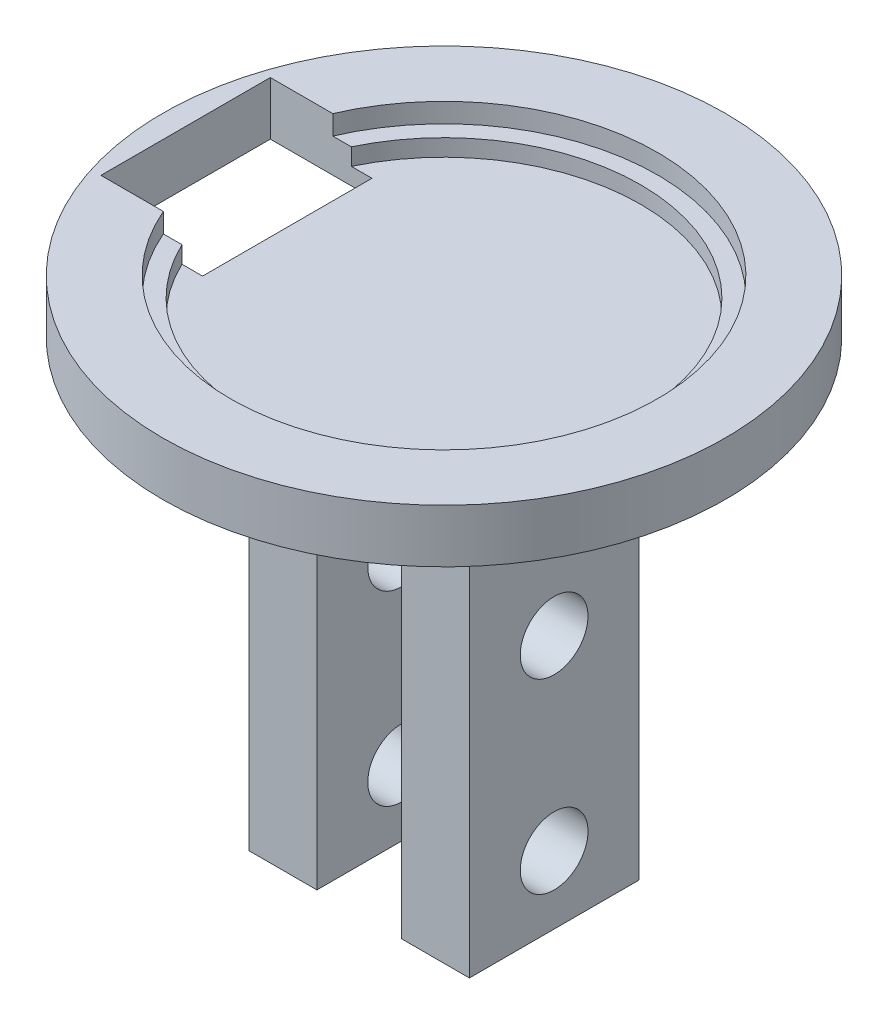
from build123d import *

# Parameters (mm, degrees)
SKETCH2_W           = 4
SKETCH2_H           = 10
BOSS_EXTRUDE1_DEPTH = 27
SKETCH3_R           = 2
CUT_EXTRUDE1_DEPTH  = 22.3
FILLET1_R           = 2.75
SKETCH6_W           = 6
SKETCH6_H           = 10
CUT_EXTRUDE4_DEPTH  = 10


with BuildPart() as part:
    # Sketch1 → Revolve1 (revolve)
    with BuildSketch(Plane.XY, mode=Mode.PRIVATE) as revolve1_sk:
        Polygon((-14.45, -3.342), (-10.45, -3.342), (-10.45, -4.492), (-9.45, -4.492), (-9.45, -5.492), (2.15, -5.492), (2.15, -6.492), (-14.45, -6.492), align=None)
    revolve(revolve1_sk.sketch.rotate(Axis((2.15, -6.492, 0), (0, 1, 0)), 270), axis=Axis((2.15, -6.492, 0), (0, 1, 0)))

    # Sketch2 → Boss-Extrude1 (add)
    with BuildSketch(Plane.XZ.offset(6.492)):
        with Locations((6.65, 0)):
            Rectangle(SKETCH2_W, SKETCH2_H)
        with Locations((-2.35, 0)):
            Rectangle(SKETCH2_W, SKETCH2_H)
    extrude(amount=BOSS_EXTRUDE1_DEPTH)

    # Sketch3 → Cut-Extrude1 (cut)
    with BuildSketch(Plane.ZY.offset(4.35)):
        with Locations((0, -29.492)):
            Circle(SKETCH3_R)
        with Locations((0, -18.492)):
            Circle(SKETCH3_R)
    extrude(amount=-CUT_EXTRUDE1_DEPTH, mode=Mode.SUBTRACT)

    # Fillet1
    # the kernel refuses this fillet: 2.75 mm, written as the material it adds along each edge
    with BuildSketch(Plane(origin=(-4.35, -6.492, -5), x_dir=(-1, 0, 0), z_dir=(0, 0, 1)), Plane(origin=(-0.35, -6.492, 5), x_dir=(1, 0, 0), z_dir=(0, 0, -1)), Plane(origin=(8.65, -6.492, 5), x_dir=(1, 0, 0), z_dir=(0, 0, -1)), Plane(origin=(4.65, -6.492, -5), x_dir=(-1, 0, 0), z_dir=(0, 0, 1))) as fillet1_piece_1:
        with BuildLine():
            CenterArc((FILLET1_R, FILLET1_R), FILLET1_R, 180, 90)
            Line((0, FILLET1_R), (0, 0))
            Line((0, 0), (FILLET1_R, 0))
        make_face()
    extrude(amount=10)
    with BuildSketch(Plane(origin=(6.525, -6.492, -5), x_dir=(0, 0, -1), z_dir=(-1, 0, 0))) as fillet1_piece_2_section:
        with BuildLine():
            CenterArc((FILLET1_R, FILLET1_R), FILLET1_R, 180, 90)
            Line((0, FILLET1_R), (0, 0))
            Line((0, 0), (FILLET1_R, 0))
        make_face()
    fillet1_piece_2 = extrude(amount=10.875, mode=Mode.PRIVATE)
    fillet1_piece_2 = split(fillet1_piece_2, bisect_by=Plane(origin=(4.65, -7.114586564, -5.622586564), z_dir=(1, 0, 0)), keep=Keep.TOP, mode=Mode.PRIVATE)
    add(fillet1_piece_2)
    with BuildSketch(Plane(origin=(-0.35, -6.492, -5), x_dir=(0, 0, -1), z_dir=(-1, 0, 0)), Plane(origin=(-4.35, -6.492, 5), x_dir=(0, 0, 1), z_dir=(1, 0, 0)), Plane(origin=(4.65, -6.492, 5), x_dir=(0, 0, 1), z_dir=(1, 0, 0)), Plane(origin=(8.65, -6.492, -5), x_dir=(0, 0, -1), z_dir=(-1, 0, 0))) as fillet1_piece_3:
        with BuildLine():
            CenterArc((FILLET1_R, FILLET1_R), FILLET1_R, 180, 90)
            Line((0, FILLET1_R), (0, 0))
            Line((0, 0), (FILLET1_R, 0))
        make_face()
    extrude(amount=4)
    with BuildSketch(Plane(origin=(-4.35, -6.492, 5), x_dir=(0, 0, 1), z_dir=(1, 0, 0))) as fillet1_piece_4_section:
        with BuildLine():
            CenterArc((FILLET1_R, FILLET1_R), FILLET1_R, 180, 90)
            Line((0, FILLET1_R), (0, 0))
            Line((0, 0), (FILLET1_R, 0))
        make_face()
    fillet1_piece_4 = extrude(amount=10.875, mode=Mode.PRIVATE)
    fillet1_piece_4 = split(fillet1_piece_4, bisect_by=Plane(origin=(4.65, -7.114586564, 5.622586564), z_dir=(1, 0, 0)), keep=Keep.TOP, mode=Mode.PRIVATE)
    add(fillet1_piece_4)
    with BuildSketch(Plane(origin=(-2.225, -6.492, 5), x_dir=(0, 0, 1), z_dir=(1, 0, 0))) as fillet1_piece_5_section:
        with BuildLine():
            CenterArc((FILLET1_R, FILLET1_R), FILLET1_R, 180, 90)
            Line((0, FILLET1_R), (0, 0))
            Line((0, 0), (FILLET1_R, 0))
        make_face()
    fillet1_piece_5 = extrude(amount=10.875, mode=Mode.PRIVATE)
    fillet1_piece_5 = split(fillet1_piece_5, bisect_by=Plane(origin=(-0.35, -7.114586564, 5.622586564), z_dir=(-1, 0, 0)), keep=Keep.TOP, mode=Mode.PRIVATE)
    add(fillet1_piece_5)
    with BuildSketch(Plane(origin=(8.65, -6.492, -5), x_dir=(0, 0, -1), z_dir=(-1, 0, 0))) as fillet1_piece_6_section:
        with BuildLine():
            CenterArc((FILLET1_R, FILLET1_R), FILLET1_R, 180, 90)
            Line((0, FILLET1_R), (0, 0))
            Line((0, 0), (FILLET1_R, 0))
        make_face()
    fillet1_piece_6 = extrude(amount=10.875, mode=Mode.PRIVATE)
    fillet1_piece_6 = split(fillet1_piece_6, bisect_by=Plane(origin=(-0.35, -7.114586564, -5.622586564), z_dir=(-1, 0, 0)), keep=Keep.TOP, mode=Mode.PRIVATE)
    add(fillet1_piece_6)
    with BuildSketch(Plane(origin=(-4.35, -6.492, -11.875), x_dir=(-1, 0, 0), z_dir=(0, 0, 1))) as fillet1_piece_7a_section:
        with BuildLine():
            CenterArc((FILLET1_R, FILLET1_R), FILLET1_R, 180, 90)
            Line((0, FILLET1_R), (0, 0))
            Line((0, 0), (FILLET1_R, 0))
        make_face()
    fillet1_piece_7a = extrude(amount=16.875, mode=Mode.PRIVATE)
    fillet1_piece_7a = split(fillet1_piece_7a, bisect_by=Plane(origin=(-4.972586564, -7.114586564, -5), z_dir=(0, 0, -1)), keep=Keep.TOP, mode=Mode.PRIVATE)
    with BuildSketch(Plane(origin=(-0.35, -6.492, -5), x_dir=(0, 0, -1), z_dir=(-1, 0, 0))) as fillet1_piece_7b_section:
        with BuildLine():
            CenterArc((FILLET1_R, FILLET1_R), FILLET1_R, 180, 90)
            Line((0, FILLET1_R), (0, 0))
            Line((0, 0), (FILLET1_R, 0))
        make_face()
    fillet1_piece_7b = extrude(amount=10.875, mode=Mode.PRIVATE)
    fillet1_piece_7b = split(fillet1_piece_7b, bisect_by=Plane(origin=(-4.35, -7.114586564, -5.622586564), z_dir=(-1, 0, 0)), keep=Keep.TOP, mode=Mode.PRIVATE)
    fillet1_piece_7 = fillet1_piece_7a & fillet1_piece_7b
    add(fillet1_piece_7)
    with BuildSketch(Plane(origin=(-4.35, -6.492, -5), x_dir=(-1, 0, 0), z_dir=(0, 0, 1))) as fillet1_piece_8a_section:
        with BuildLine():
            CenterArc((FILLET1_R, FILLET1_R), FILLET1_R, 180, 90)
            Line((0, FILLET1_R), (0, 0))
            Line((0, 0), (FILLET1_R, 0))
        make_face()
    fillet1_piece_8a = extrude(amount=16.875, mode=Mode.PRIVATE)
    fillet1_piece_8a = split(fillet1_piece_8a, bisect_by=Plane(origin=(-4.972586564, -7.114586564, 5), z_dir=(0, 0, 1)), keep=Keep.TOP, mode=Mode.PRIVATE)
    with BuildSketch(Plane(origin=(-11.225, -6.492, 5), x_dir=(0, 0, 1), z_dir=(1, 0, 0))) as fillet1_piece_8b_section:
        with BuildLine():
            CenterArc((FILLET1_R, FILLET1_R), FILLET1_R, 180, 90)
            Line((0, FILLET1_R), (0, 0))
            Line((0, 0), (FILLET1_R, 0))
        make_face()
    fillet1_piece_8b = extrude(amount=10.875, mode=Mode.PRIVATE)
    fillet1_piece_8b = split(fillet1_piece_8b, bisect_by=Plane(origin=(-4.35, -7.114586564, 5.622586564), z_dir=(-1, 0, 0)), keep=Keep.TOP, mode=Mode.PRIVATE)
    fillet1_piece_8 = fillet1_piece_8a & fillet1_piece_8b
    add(fillet1_piece_8)
    with BuildSketch(Plane(origin=(6.525, -6.492, -5), x_dir=(0, 0, -1), z_dir=(-1, 0, 0))) as fillet1_piece_9a_section:
        with BuildLine():
            CenterArc((FILLET1_R, FILLET1_R), FILLET1_R, 180, 90)
            Line((0, FILLET1_R), (0, 0))
            Line((0, 0), (FILLET1_R, 0))
        make_face()
    fillet1_piece_9a = extrude(amount=10.875, mode=Mode.PRIVATE)
    fillet1_piece_9a = split(fillet1_piece_9a, bisect_by=Plane(origin=(4.65, -7.114586564, -5.622586564), z_dir=(-1, 0, 0)), keep=Keep.TOP, mode=Mode.PRIVATE)
    fillet1_piece_9a = split(fillet1_piece_9a, bisect_by=Plane(origin=(-0.35, -7.114586564, -5.622586564), z_dir=(1, 0, 0)), keep=Keep.TOP, mode=Mode.PRIVATE)
    with BuildSketch(Plane(origin=(-0.35, -6.492, 5), x_dir=(1, 0, 0), z_dir=(0, 0, -1))) as fillet1_piece_9b_section:
        with BuildLine():
            CenterArc((FILLET1_R, FILLET1_R), FILLET1_R, 180, 90)
            Line((0, FILLET1_R), (0, 0))
            Line((0, 0), (FILLET1_R, 0))
        make_face()
    fillet1_piece_9b = extrude(amount=16.875, mode=Mode.PRIVATE)
    fillet1_piece_9b = split(fillet1_piece_9b, bisect_by=Plane(origin=(0.272586564, -7.114586564, -5), z_dir=(0, 0, -1)), keep=Keep.TOP, mode=Mode.PRIVATE)
    fillet1_piece_9 = fillet1_piece_9a & fillet1_piece_9b
    add(fillet1_piece_9)
    with BuildSketch(Plane(origin=(-0.35, -6.492, 11.875), x_dir=(1, 0, 0), z_dir=(0, 0, -1))) as fillet1_piece_10a_section:
        with BuildLine():
            CenterArc((FILLET1_R, FILLET1_R), FILLET1_R, 180, 90)
            Line((0, FILLET1_R), (0, 0))
            Line((0, 0), (FILLET1_R, 0))
        make_face()
    fillet1_piece_10a = extrude(amount=16.875, mode=Mode.PRIVATE)
    fillet1_piece_10a = split(fillet1_piece_10a, bisect_by=Plane(origin=(0.272586564, -7.114586564, 5), z_dir=(0, 0, 1)), keep=Keep.TOP, mode=Mode.PRIVATE)
    with BuildSketch(Plane(origin=(-4.35, -6.492, 5), x_dir=(0, 0, 1), z_dir=(1, 0, 0))) as fillet1_piece_10b_section:
        with BuildLine():
            CenterArc((FILLET1_R, FILLET1_R), FILLET1_R, 180, 90)
            Line((0, FILLET1_R), (0, 0))
            Line((0, 0), (FILLET1_R, 0))
        make_face()
    fillet1_piece_10b = extrude(amount=10.875, mode=Mode.PRIVATE)
    fillet1_piece_10b = split(fillet1_piece_10b, bisect_by=Plane(origin=(4.65, -7.114586564, 5.622586564), z_dir=(-1, 0, 0)), keep=Keep.TOP, mode=Mode.PRIVATE)
    fillet1_piece_10b = split(fillet1_piece_10b, bisect_by=Plane(origin=(-0.35, -7.114586564, 5.622586564), z_dir=(1, 0, 0)), keep=Keep.TOP, mode=Mode.PRIVATE)
    fillet1_piece_10 = fillet1_piece_10a & fillet1_piece_10b
    add(fillet1_piece_10)
    with BuildSketch(Plane(origin=(8.65, -6.492, 11.875), x_dir=(1, 0, 0), z_dir=(0, 0, -1))) as fillet1_piece_11a_section:
        with BuildLine():
            CenterArc((FILLET1_R, FILLET1_R), FILLET1_R, 180, 90)
            Line((0, FILLET1_R), (0, 0))
            Line((0, 0), (FILLET1_R, 0))
        make_face()
    fillet1_piece_11a = extrude(amount=16.875, mode=Mode.PRIVATE)
    fillet1_piece_11a = split(fillet1_piece_11a, bisect_by=Plane(origin=(9.272586564, -7.114586564, 5), z_dir=(0, 0, 1)), keep=Keep.TOP, mode=Mode.PRIVATE)
    with BuildSketch(Plane(origin=(4.65, -6.492, 5), x_dir=(0, 0, 1), z_dir=(1, 0, 0))) as fillet1_piece_11b_section:
        with BuildLine():
            CenterArc((FILLET1_R, FILLET1_R), FILLET1_R, 180, 90)
            Line((0, FILLET1_R), (0, 0))
            Line((0, 0), (FILLET1_R, 0))
        make_face()
    fillet1_piece_11b = extrude(amount=10.875, mode=Mode.PRIVATE)
    fillet1_piece_11b = split(fillet1_piece_11b, bisect_by=Plane(origin=(8.65, -7.114586564, 5.622586564), z_dir=(1, 0, 0)), keep=Keep.TOP, mode=Mode.PRIVATE)
    fillet1_piece_11 = fillet1_piece_11a & fillet1_piece_11b
    add(fillet1_piece_11)
    with BuildSketch(Plane(origin=(8.65, -6.492, 5), x_dir=(1, 0, 0), z_dir=(0, 0, -1))) as fillet1_piece_12a_section:
        with BuildLine():
            CenterArc((FILLET1_R, FILLET1_R), FILLET1_R, 180, 90)
            Line((0, FILLET1_R), (0, 0))
            Line((0, 0), (FILLET1_R, 0))
        make_face()
    fillet1_piece_12a = extrude(amount=16.875, mode=Mode.PRIVATE)
    fillet1_piece_12a = split(fillet1_piece_12a, bisect_by=Plane(origin=(9.272586564, -7.114586564, -5), z_dir=(0, 0, -1)), keep=Keep.TOP, mode=Mode.PRIVATE)
    with BuildSketch(Plane(origin=(15.525, -6.492, -5), x_dir=(0, 0, -1), z_dir=(-1, 0, 0))) as fillet1_piece_12b_section:
        with BuildLine():
            CenterArc((FILLET1_R, FILLET1_R), FILLET1_R, 180, 90)
            Line((0, FILLET1_R), (0, 0))
            Line((0, 0), (FILLET1_R, 0))
        make_face()
    fillet1_piece_12b = extrude(amount=10.875, mode=Mode.PRIVATE)
    fillet1_piece_12b = split(fillet1_piece_12b, bisect_by=Plane(origin=(8.65, -7.114586564, -5.622586564), z_dir=(1, 0, 0)), keep=Keep.TOP, mode=Mode.PRIVATE)
    fillet1_piece_12 = fillet1_piece_12a & fillet1_piece_12b
    add(fillet1_piece_12)
    with BuildSketch(Plane(origin=(-2.225, -6.492, 5), x_dir=(0, 0, 1), z_dir=(1, 0, 0))) as fillet1_piece_13a_section:
        with BuildLine():
            CenterArc((FILLET1_R, FILLET1_R), FILLET1_R, 180, 90)
            Line((0, FILLET1_R), (0, 0))
            Line((0, 0), (FILLET1_R, 0))
        make_face()
    fillet1_piece_13a = extrude(amount=10.875, mode=Mode.PRIVATE)
    fillet1_piece_13a = split(fillet1_piece_13a, bisect_by=Plane(origin=(4.65, -7.114586564, 5.622586564), z_dir=(-1, 0, 0)), keep=Keep.TOP, mode=Mode.PRIVATE)
    fillet1_piece_13a = split(fillet1_piece_13a, bisect_by=Plane(origin=(-0.35, -7.114586564, 5.622586564), z_dir=(1, 0, 0)), keep=Keep.TOP, mode=Mode.PRIVATE)
    with BuildSketch(Plane(origin=(4.65, -6.492, -5), x_dir=(-1, 0, 0), z_dir=(0, 0, 1))) as fillet1_piece_13b_section:
        with BuildLine():
            CenterArc((FILLET1_R, FILLET1_R), FILLET1_R, 180, 90)
            Line((0, FILLET1_R), (0, 0))
            Line((0, 0), (FILLET1_R, 0))
        make_face()
    fillet1_piece_13b = extrude(amount=16.875, mode=Mode.PRIVATE)
    fillet1_piece_13b = split(fillet1_piece_13b, bisect_by=Plane(origin=(4.027413436, -7.114586564, 5), z_dir=(0, 0, 1)), keep=Keep.TOP, mode=Mode.PRIVATE)
    fillet1_piece_13 = fillet1_piece_13a & fillet1_piece_13b
    add(fillet1_piece_13)
    with BuildSketch(Plane(origin=(4.65, -6.492, -11.875), x_dir=(-1, 0, 0), z_dir=(0, 0, 1))) as fillet1_piece_14a_section:
        with BuildLine():
            CenterArc((FILLET1_R, FILLET1_R), FILLET1_R, 180, 90)
            Line((0, FILLET1_R), (0, 0))
            Line((0, 0), (FILLET1_R, 0))
        make_face()
    fillet1_piece_14a = extrude(amount=16.875, mode=Mode.PRIVATE)
    fillet1_piece_14a = split(fillet1_piece_14a, bisect_by=Plane(origin=(4.027413436, -7.114586564, -5), z_dir=(0, 0, -1)), keep=Keep.TOP, mode=Mode.PRIVATE)
    with BuildSketch(Plane(origin=(8.65, -6.492, -5), x_dir=(0, 0, -1), z_dir=(-1, 0, 0))) as fillet1_piece_14b_section:
        with BuildLine():
            CenterArc((FILLET1_R, FILLET1_R), FILLET1_R, 180, 90)
            Line((0, FILLET1_R), (0, 0))
            Line((0, 0), (FILLET1_R, 0))
        make_face()
    fillet1_piece_14b = extrude(amount=10.875, mode=Mode.PRIVATE)
    fillet1_piece_14b = split(fillet1_piece_14b, bisect_by=Plane(origin=(4.65, -7.114586564, -5.622586564), z_dir=(-1, 0, 0)), keep=Keep.TOP, mode=Mode.PRIVATE)
    fillet1_piece_14b = split(fillet1_piece_14b, bisect_by=Plane(origin=(-0.35, -7.114586564, -5.622586564), z_dir=(1, 0, 0)), keep=Keep.TOP, mode=Mode.PRIVATE)
    fillet1_piece_14 = fillet1_piece_14a & fillet1_piece_14b
    add(fillet1_piece_14)

    # Sketch6 → Cut-Extrude4 (cut)
    with BuildSketch(Plane.XZ.offset(6.492)):
        with Locations((-10.1, 0)):
            Rectangle(SKETCH6_W, SKETCH6_H)
    extrude(amount=-CUT_EXTRUDE4_DEPTH, mode=Mode.SUBTRACT)


solid = part.part
